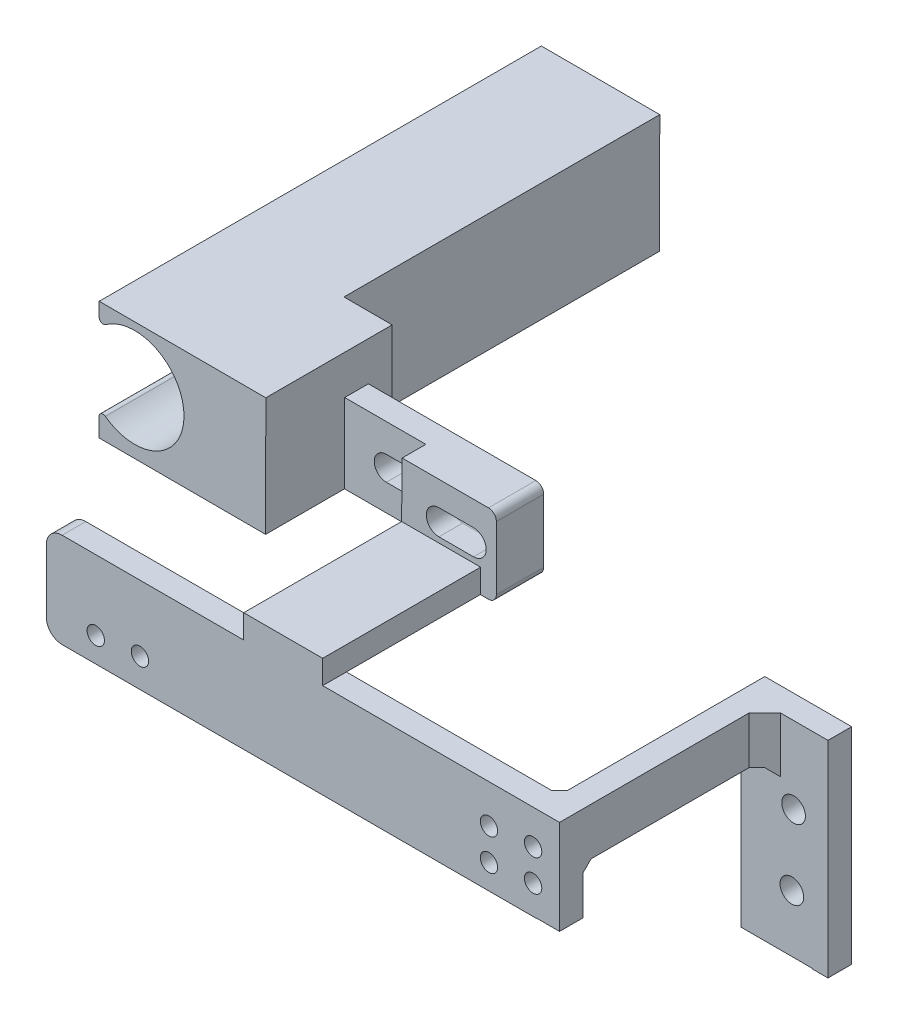
from build123d import *

# Parameters (mm, degrees)
EXTRUDE_1_DEPTH                 = 26
HOLE_START                      = -8.449868074
HOLE_WIZARD_3_0_3_1_OUTLINE_R   = 1.5
HOLE_WIZARD_3_0_3_1_DEPTH       = 3
SKETCH_11_W                     = 26
SKETCH_11_H                     = 20
CUT_EXTRUDE_1_DEPTH             = 3
SKETCH_14_W                     = 62
SKETCH_14_H                     = 14
CUT_EXTRUDE_2_DEPTH             = 3
SKETCH_18_W                     = 3
SKETCH_18_H                     = 5.960488001
EXTRUDE_5_DEPTH                 = 3
HOLE_START_2                    = 17.550131926
HOLE_WIZARD_3_0_2_2_1_OUTLINE_R = 1.1
HOLE_WIZARD_3_0_2_2_1_DEPTH     = 3
HOLE_WIZARD_3_0_2_2_2_OUTLINE_R = 1.1
HOLE_WIZARD_3_0_2_2_2_DEPTH     = 3
HOLE_WIZARD_3_0_2_2_3_OUTLINE_R = 1.1
HOLE_WIZARD_3_0_2_2_3_DEPTH     = 3
HOLE_WIZARD_3_0_2_2_4_OUTLINE_R = 1.1
HOLE_WIZARD_3_0_2_2_4_DEPTH     = 3
CHAMFER_1_SIZE                  = 1
CHAMFER_2_SIZE                  = 2
CHAMFER_3_SIZE                  = 1
SKETCH_45_W                     = 3
SKETCH_45_H                     = 26.068743285
EXTRUDE_6_DEPTH                 = 2
CHAMFER_4_SIZE                  = 1
SKETCH_64_W                     = 5
SKETCH_64_H                     = 3
EXTRUDE_11_DEPTH                = 5
SKETCH_65_W                     = 5
SKETCH_65_H                     = 4.928929729
EXTRUDE_12_DEPTH                = 20
SKETCH_68_W                     = 5
SKETCH_68_H                     = 3
EXTRUDE_13_DEPTH                = 5
SKETCH_70_W                     = 3
SKETCH_70_H                     = 5.006023724
EXTRUDE_14_DEPTH                = 4
SKETCH_71_W                     = 3
SKETCH_71_H                     = 4.998374441
EXTRUDE_15_DEPTH                = 3
SKETCH_73_W                     = 20
SKETCH_73_H                     = 2.154918848
CUT_EXTRUDE_5_DEPTH             = 5
FILLET_1_R                      = 2
EXTRUDE_START                   = -3
SKETCH_80_R                     = 1.5
EXTRUDE_16_DEPTH                = 3
HOLE_WIZARD_3_0_3_2_OUTLINE_R   = 1.5
HOLE_WIZARD_3_0_3_2_DEPTH       = 3
SKETCH_88_W                     = 5
SKETCH_88_H                     = 3
EXTRUDE_20_DEPTH                = 5
SKETCH_89_W                     = 5
SKETCH_89_H                     = 2.54765363
EXTRUDE_21_DEPTH                = 20
SKETCH_92_W                     = 2.009733892
SKETCH_92_H                     = 3
EXTRUDE_22_DEPTH                = 5
SKETCH_93_W                     = 4.064903442
SKETCH_93_H                     = 5.006023724
CUT_EXTRUDE_6_DEPTH             = 5
SKETCH_94_W                     = 3
SKETCH_94_H                     = 7.492263756
EXTRUDE_23_DEPTH                = 2
EXTRUDE_24_DEPTH                = 20
SKETCH_101_W                    = 2
SKETCH_101_H                    = 2.53530172
EXTRUDE_25_DEPTH                = 3
SKETCH_102_W                    = 20
SKETCH_102_H                    = 2
CUT_EXTRUDE_8_DEPTH             = 10
CUT_EXTRUDE_9_DEPTH             = 3
SKETCH_112_W                    = 22.23
SKETCH_112_H                    = 10.027565476
EXTRUDE_26_DEPTH                = 3
CUT_EXTRUDE_10_DEPTH            = 3
HOLE_WIZARD_3_0_3_3_D           = 3
HOLE_WIZARD_3_0_3_3_DEPTH       = 5
HOLE_WIZARD_3_0_3_3_TIP         = 0.901290929
EXTRUDE_27_DEPTH                = 3
FILLET_2_R                      = 1
CUT_EXTRUDE_13_DEPTH            = 6
EXTRUDE_28_DEPTH                = 6
EXTRUDE_29_DEPTH                = 40
EXTRUDE_30_DEPTH                = 10
SKETCH_126_R                    = 6.25
CUT_EXTRUDE_14_DEPTH            = 56
FILLET_3_R                      = 0.5
FILLET_4_R                      = 0.5


# Read off the part's stored shape, not the designer's step: Ø3.0 (3) 直径孔1, Ø3.0 (2.2) 直径孔1, Ø3.0 (2.2) 直径孔2, Ø3.0 (2.2) 直径孔3, Ø3.0 (2.2) 直径孔4, Ø3.0 (3) 直径孔2
with BuildPart() as part:
    # 草图4 → 凸台-拉伸1 (new body)
    with BuildSketch(Plane(origin=(0, 0, 0), x_dir=(1, 0, 0), z_dir=(0, 1, 0))):
        Polygon((-71.345646438, -20.550131926), (-6.345646438, -20.550131926), (-6.345646438, 5.449868074), (-0.345646438, 5.449868074), (-0.345646438, 8.449868074), (-9.345646438, 8.449868074), (-9.345646438, -17.550131926), (-71.345646438, -17.550131926), align=None)
    extrude(amount=EXTRUDE_1_DEPTH)

    # Ø3.0 (3) 直径孔1 outline → Ø3.0 (3) 直径孔1 (cut)
    with BuildSketch(Plane.XY.offset(HOLE_START)):
        with Locations((-2.70204226, 8.045696334)):
            Circle(HOLE_WIZARD_3_0_3_1_OUTLINE_R)
        with Locations((-2.70204226, 16.245696334)):
            Circle(HOLE_WIZARD_3_0_3_1_OUTLINE_R)
    extrude(amount=HOLE_WIZARD_3_0_3_1_DEPTH, mode=Mode.SUBTRACT)

    # 草图11 → 切除-拉伸1 (cut)
    with BuildSketch(Plane(origin=(-6.345646438, 0, 0), x_dir=(0, 0, -1), z_dir=(1, 0, 0))):
        with Locations((-7.550131926, 10)):
            Rectangle(SKETCH_11_W, SKETCH_11_H)
    extrude(amount=-CUT_EXTRUDE_1_DEPTH, mode=Mode.SUBTRACT)

    # 草图14 → 切除-拉伸2 (cut)
    with BuildSketch(Plane.XY.offset(20.550131926)):
        with Locations((-40.345646438, 7)):
            Rectangle(SKETCH_14_W, SKETCH_14_H)
    extrude(amount=-CUT_EXTRUDE_2_DEPTH, mode=Mode.SUBTRACT)

    # 草图18 → 凸台-拉伸5 (add)
    with BuildSketch(Plane(origin=(-9.345646438, 0, 0), x_dir=(0, 0, -1), z_dir=(1, 0, 0))):
        with Locations((-19.050131926, 17.019755999)):
            Rectangle(SKETCH_18_W, SKETCH_18_H)
    extrude(amount=EXTRUDE_5_DEPTH)

    # Ø3.0 (2.2) 直径孔1 outline → Ø3.0 (2.2) 直径孔1 (cut)
    with BuildSketch(Plane.XY.offset(HOLE_START_2)):
        with Locations((-9.692746544, 17.658013179)):
            Circle(HOLE_WIZARD_3_0_2_2_1_OUTLINE_R)
    extrude(amount=HOLE_WIZARD_3_0_2_2_1_DEPTH, mode=Mode.SUBTRACT)

    # Hole Wizard 3.0 _2.2_ _1 2 outline → Hole Wizard 3.0 _2.2_ _1 2 (revolve, cut)
    with BuildSketch(Plane(origin=(-9.692746544, 21.658013179, 0), x_dir=(1, 0, 0), z_dir=(0, -1, 0))):
        Polygon((0.346891917, 15.097618937), (1.100000001, 15.550131926), (1.1, 20.550131926), (0, 20.550131926), (0, 15.097618937), align=None)
    revolve(axis=Axis((-9.692746544, 21.658013179, 0), (0, 0, 1)), mode=Mode.SUBTRACT)

    # Ø3.0 (2.2) 直径孔2 outline → Ø3.0 (2.2) 直径孔2 (cut)
    with BuildSketch(Plane.XY.offset(HOLE_START_2)):
        with Locations((-59.492746544, 17.658013179)):
            Circle(HOLE_WIZARD_3_0_2_2_2_OUTLINE_R)
    extrude(amount=HOLE_WIZARD_3_0_2_2_2_DEPTH, mode=Mode.SUBTRACT)

    # Ø3.0 (2.2) 直径孔3 outline → Ø3.0 (2.2) 直径孔3 (cut)
    with BuildSketch(Plane.XY.offset(HOLE_START_2)):
        with Locations((-15.287259423, 17.132806202)):
            Circle(HOLE_WIZARD_3_0_2_2_3_OUTLINE_R)
        with Locations((-15.287259423, 21.132806202)):
            Circle(HOLE_WIZARD_3_0_2_2_3_OUTLINE_R)
    extrude(amount=HOLE_WIZARD_3_0_2_2_3_DEPTH, mode=Mode.SUBTRACT)

    # Ø3.0 (2.2) 直径孔4 outline → Ø3.0 (2.2) 直径孔4 (cut)
    with BuildSketch(Plane.XY.offset(HOLE_START_2)):
        with Locations((-65.087259423, 17.132806202)):
            Circle(HOLE_WIZARD_3_0_2_2_4_OUTLINE_R)
    extrude(amount=HOLE_WIZARD_3_0_2_2_4_DEPTH, mode=Mode.SUBTRACT)

    # 倒角1
    chamfer_1_edges = [part.edges().sort_by_distance(p)[0] for p in [
        (-9.345646438, 24.350907327, 17.550131926),
    ]]
    chamfer(chamfer_1_edges, length=CHAMFER_1_SIZE)

    # 倒角2
    chamfer_2_edges = [part.edges().sort_by_distance(p)[0] for p in [
        (-6.345646438, 23, -5.449868074),
    ]]
    chamfer(chamfer_2_edges, length=CHAMFER_2_SIZE)

    # 倒角3
    chamfer_3_edges = [part.edges().sort_by_distance(p)[0] for p in [
        (-7.845646438, 20, 17.550131926),
    ]]
    chamfer(chamfer_3_edges, length=CHAMFER_3_SIZE)

    # 草图45 → 凸台-拉伸6 (add)
    with BuildSketch(Plane(origin=(-0.345646438, 0, 0), x_dir=(0, 0, -1), z_dir=(1, 0, 0))):
        with Locations((6.949868074, 12.965628357)):
            Rectangle(SKETCH_45_W, SKETCH_45_H)
    extrude(amount=EXTRUDE_6_DEPTH)

    # 倒角4
    chamfer_4_edges = [part.edges().sort_by_distance(p)[0] for p in [
        (-6.845646438, 20, -5.449868074),
    ]]
    chamfer(chamfer_4_edges, length=CHAMFER_4_SIZE)

    # 草图64 → 凸台-拉伸11 (add)
    with BuildSketch(Plane(origin=(0, 26, 0), x_dir=(1, 0, 0), z_dir=(0, 1, 0))):
        with Locations((-43.845646438, -19.050131926)):
            Rectangle(SKETCH_64_W, SKETCH_64_H)
    extrude(amount=EXTRUDE_11_DEPTH)

    # 草图65 → 凸台-拉伸12 (add)
    with BuildSketch(Plane(origin=(0, 0, 17.550131926), x_dir=(-1, 0, 0), z_dir=(0, 0, -1))):
        with Locations((43.845646438, 28.535535136)):
            Rectangle(SKETCH_65_W, SKETCH_65_H)
    extrude(amount=EXTRUDE_12_DEPTH)

    # 草图68 → 凸台-拉伸13 (add)
    with BuildSketch(Plane(origin=(0, 31, 0), x_dir=(1, 0, 0), z_dir=(0, 1, 0))):
        with Locations((-43.845646438, 0.949868074)):
            Rectangle(SKETCH_68_W, SKETCH_68_H)
    extrude(amount=EXTRUDE_13_DEPTH)

    # 草图70 → 凸台-拉伸14 (add)
    with BuildSketch(Plane.ZY.offset(46.345646438)):
        with Locations((-0.949868074, 33.496988138)):
            Rectangle(SKETCH_70_W, SKETCH_70_H)
    extrude(amount=EXTRUDE_14_DEPTH)

    # 草图71 → 凸台-拉伸15 (add)
    with BuildSketch(Plane(origin=(-41.345646438, 0, 0), x_dir=(0, 0, -1), z_dir=(1, 0, 0))):
        with Locations((0.949868074, 33.50081278)):
            Rectangle(SKETCH_71_W, SKETCH_71_H)
    extrude(amount=EXTRUDE_15_DEPTH)

    # 草图73 → 切除-拉伸5 (cut)
    with BuildSketch(Plane.ZY.offset(46.345646438)):
        with Locations((7.550131926, 27.148529695)):
            Rectangle(SKETCH_73_W, SKETCH_73_H)
    extrude(amount=-CUT_EXTRUDE_5_DEPTH, mode=Mode.SUBTRACT)

    # 圆角1
    fillet_1_edges = [part.edges().sort_by_distance(p)[0] for p in [
        (-71.345646438, 26, 19.050131926),
        (-71.345646438, 14, 19.050131926),
    ]]
    fillet(fillet_1_edges, radius=FILLET_1_R)

    # 草图80 → 凸台-拉伸16 (add)
    with BuildSketch(Plane.XY.offset(-5.449868074).offset(EXTRUDE_START)):
        with Locations((-2.70204226, 8.045696334)):
            Circle(SKETCH_80_R)
    extrude(amount=EXTRUDE_16_DEPTH)

    # Ø3.0 (3) 直径孔2 outline → Ø3.0 (3) 直径孔2 (cut)
    with BuildSketch(Plane.XY.offset(HOLE_START)):
        with Locations((-2.916721347, 7.245696334)):
            Circle(HOLE_WIZARD_3_0_3_2_OUTLINE_R)
    extrude(amount=HOLE_WIZARD_3_0_3_2_DEPTH, mode=Mode.SUBTRACT)

    # 草图88 → 凸台-拉伸20 (add)
    with BuildSketch(Plane(origin=(0, 26, 0), x_dir=(1, 0, 0), z_dir=(0, 1, 0))):
        with Locations((-38.845646438, -19.050131926)):
            Rectangle(SKETCH_88_W, SKETCH_88_H)
    extrude(amount=EXTRUDE_20_DEPTH)

    # 草图89 → 凸台-拉伸21 (add)
    with BuildSketch(Plane(origin=(0, 0, 17.550131926), x_dir=(-1, 0, 0), z_dir=(0, 0, -1))):
        with Locations((38.845646438, 29.726173185)):
            Rectangle(SKETCH_89_W, SKETCH_89_H)
    extrude(amount=EXTRUDE_21_DEPTH)

    # 草图92 → 凸台-拉伸22 (add)
    with BuildSketch(Plane(origin=(0, 31, 0), x_dir=(1, 0, 0), z_dir=(0, 1, 0))):
        with Locations((-37.350513384, 0.949868074)):
            Rectangle(SKETCH_92_W, SKETCH_92_H)
    extrude(amount=EXTRUDE_22_DEPTH)

    # 草图93 → 切除-拉伸6 (cut)
    with BuildSketch(Plane.XY.offset(0.550131926)):
        with Locations((-48.313194717, 33.496988138)):
            Rectangle(SKETCH_93_W, SKETCH_93_H)
    extrude(amount=-CUT_EXTRUDE_6_DEPTH, mode=Mode.SUBTRACT)

    # 草图94 → 凸台-拉伸23 (add)
    with BuildSketch(Plane(origin=(-36.345646438, 0, 0), x_dir=(0, 0, -1), z_dir=(1, 0, 0))):
        with Locations((0.949868074, 32.253868122)):
            Rectangle(SKETCH_94_W, SKETCH_94_H)
    extrude(amount=EXTRUDE_23_DEPTH)

    # 草图100 → 凸台-拉伸24 (add)
    with BuildSketch(Plane(origin=(0, 0, 17.550131926), x_dir=(-1, 0, 0), z_dir=(0, 0, -1))):
        Polygon((36.345646438, 28.45234637), (41.345646438, 28.45234637), (41.345646438, 28.225989119), (46.345646438, 28.225989119), (46.345646438, 26), (36.345646438, 26), align=None)
    extrude(amount=EXTRUDE_24_DEPTH)

    # 草图101 → 凸台-拉伸25 (add)
    with BuildSketch(Plane(origin=(0, 0, -2.449868074), x_dir=(-1, 0, 0), z_dir=(0, 0, -1))):
        with Locations((35.345646438, 27.240085384)):
            Rectangle(SKETCH_101_W, SKETCH_101_H)
    extrude(amount=-EXTRUDE_25_DEPTH)

    # 草图102 → 切除-拉伸8 (cut)
    with BuildSketch(Plane.ZY.offset(46.345646438)):
        with Locations((10.550131926, 30)):
            Rectangle(SKETCH_102_W, SKETCH_102_H)
    extrude(amount=-CUT_EXTRUDE_8_DEPTH, mode=Mode.SUBTRACT)

    # 草图109 → 切除-拉伸9 (cut)
    with BuildSketch(Plane.XY.offset(0.550131926)):
        with BuildLine():
            Line((-37.236525371, 29.683707729), (-41.625380126, 29.683707729))
            ThreePointArc((-41.625380126, 29.683707729), (-43.224486744, 31.282814348), (-41.625380126, 32.881920967))
            Line((-41.625380126, 32.881920967), (-37.236525371, 32.881920967))
            ThreePointArc((-37.236525371, 32.881920967), (-35.637418752, 31.282814348), (-37.236525371, 29.683707729))
        make_face()
    extrude(amount=-CUT_EXTRUDE_9_DEPTH, mode=Mode.SUBTRACT)

    # 草图112 → 凸台-拉伸26 (add)
    with BuildSketch(Plane(origin=(0, 0, -2.449868074), x_dir=(-1, 0, 0), z_dir=(0, 0, -1))):
        with Locations((45.460646438, 30.986217262)):
            Rectangle(SKETCH_112_W, SKETCH_112_H)
    extrude(amount=EXTRUDE_26_DEPTH)

    # 草图113 → 切除-拉伸10 (cut)
    with BuildSketch(Plane.XY.offset(-2.449868074)):
        with BuildLine():
            Line((-37.236525371, 29.658436642), (-41.625380126, 29.658436642))
            ThreePointArc((-41.625380126, 29.658436642), (-43.249757832, 31.282814348), (-41.625380126, 32.907192054))
            Line((-41.625380126, 32.907192054), (-37.236525371, 32.907192054))
            ThreePointArc((-37.236525371, 32.907192054), (-35.612147664, 31.282814348), (-37.236525371, 29.658436642))
        make_face()
    extrude(amount=-CUT_EXTRUDE_10_DEPTH, mode=Mode.SUBTRACT)

    # Ø3.0 (3) 直径孔3
    with Locations(Plane(origin=(0, 0, -5.449868074), x_dir=(-1, 0, 0), z_dir=(0, 0, -1))):
        with Locations((49.466328148, 30.872434524)):
            Hole(HOLE_WIZARD_3_0_3_3_D / 2, depth=HOLE_WIZARD_3_0_3_3_DEPTH)
            with Locations((0, 0, -(HOLE_WIZARD_3_0_3_3_DEPTH + HOLE_WIZARD_3_0_3_3_TIP / 2))):  # 118° drill point
                Cone(0, HOLE_WIZARD_3_0_3_3_D / 2, HOLE_WIZARD_3_0_3_3_TIP, mode=Mode.SUBTRACT)

    # 草图117 → 凸台-拉伸27 (add, symmetric)
    with BuildSketch(Plane(origin=(0, 0, -5.449868074), x_dir=(-1, 0, 0), z_dir=(0, 0, -1))):
        Polygon((56.575646438, 25.972434524), (71.675646438, 26), (71.648263514, 41), (56.548263514, 40.972434524), align=None)
    extrude(amount=EXTRUDE_27_DEPTH, both=True)

    # 圆角2
    fillet_2_edges = [part.edges().sort_by_distance(p)[0] for p in [
        (-34.345646438, 36, -2.449868074),
        (-34.345646438, 25.972434524, -2.449868074),
    ]]
    fillet(fillet_2_edges, radius=FILLET_2_R)

    # 草图120 → 切除-拉伸13 (cut)
    with BuildSketch(Plane.XY.offset(-2.449868074)):
        with BuildLine():
            Line((-48.605927595, 29.341001888), (-51.282166157, 29.341001888))
            ThreePointArc((-51.282166157, 29.341001888), (-52.813598792, 30.872434524), (-51.282166157, 32.403867159))
            Line((-51.282166157, 32.403867159), (-48.605927595, 32.403867159))
            ThreePointArc((-48.605927595, 32.403867159), (-47.074494959, 30.872434524), (-48.605927595, 29.341001888))
        make_face()
    extrude(amount=-CUT_EXTRUDE_13_DEPTH, mode=Mode.SUBTRACT)

    # 草图122 → 凸台-拉伸28 (add)
    with BuildSketch(Plane.XY.offset(-2.449868074)):
        Polygon((-71.648263514, 41), (-71.675646438, 26), (-77.675646438, 26.010953169), (-77.648263514, 41.010953169), align=None)
    extrude(amount=-EXTRUDE_28_DEPTH)

    # 草图123 → 凸台-拉伸29 (add)
    with BuildSketch(Plane(origin=(0, 0, -8.449868074), x_dir=(-1, 0, 0), z_dir=(0, 0, -1))):
        Polygon((77.648263514, 41.010953169), (77.675646438, 26.010953169), (62.675646438, 25.983570246), (62.648263514, 40.983570246), align=None)
    extrude(amount=EXTRUDE_29_DEPTH)

    # 草图125 → 凸台-拉伸30 (add)
    with BuildSketch(Plane.XY.offset(-2.449868074)):
        Polygon((-77.648263514, 41.010953169), (-77.675646438, 26.010953169), (-56.575646438, 25.972434524), (-56.548263514, 40.972434524), align=None)
    extrude(amount=EXTRUDE_30_DEPTH)

    # 草图126 → 切除-拉伸14 (cut)
    with BuildSketch(Plane(origin=(0, 0, -48.449868074), x_dir=(-1, 0, 0), z_dir=(0, 0, -1))):
        with Locations((73.161417861, 33.801070433)):
            Circle(SKETCH_126_R)
    extrude(amount=-CUT_EXTRUDE_14_DEPTH, mode=Mode.SUBTRACT)

    # 圆角3
    fillet_3_edges = [part.edges().sort_by_distance(p)[0] for p in [
        (-77.653492443, 38.146615963, -20.449868074),
    ]]
    fillet(fillet_3_edges, radius=FILLET_3_R)

    # 圆角4
    fillet_4_edges = [part.edges().sort_by_distance(p)[0] for p in [
        (-77.669328282, 29.471954631, -20.449868074),
    ]]
    fillet(fillet_4_edges, radius=FILLET_4_R)


solid = part.part
